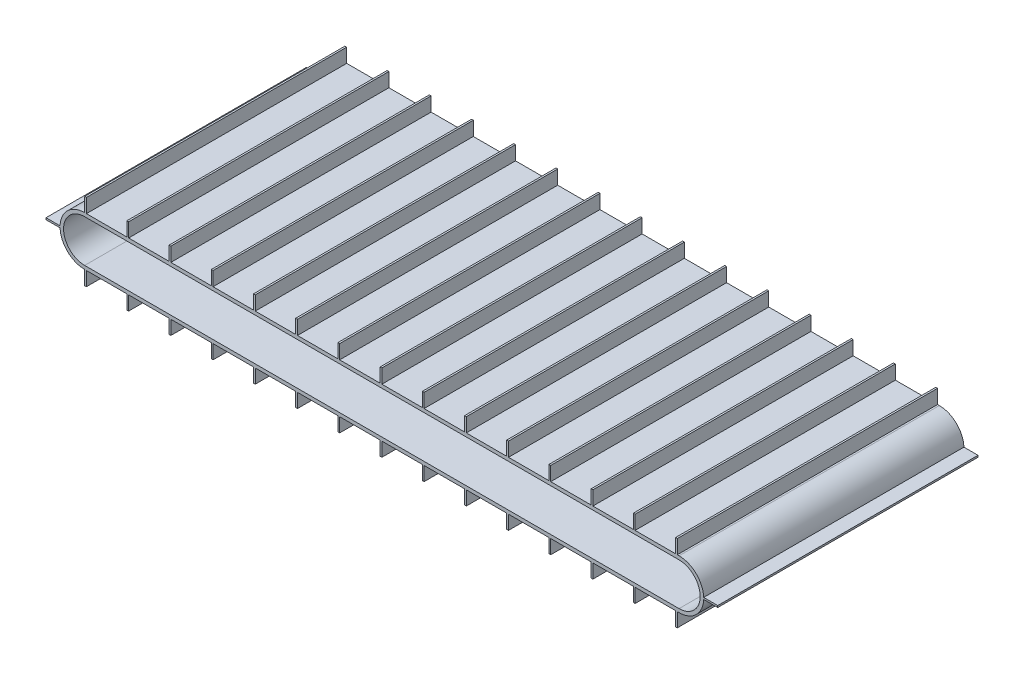
from build123d import *

# Parameters (mm, degrees)
BOSS_EXTRUDE1_DEPTH      = 234.95
SKETCH3_W                = 1.5875
SKETCH3_H                = 12.7
BOSS_EXTRUDE3_DEPTH      = 234.95
LPATTERN1_COUNT          = 15
LPATTERN1_PITCH          = 38.1
MIRROR1_COPY_1_SKETCH_W  = 1.5875
MIRROR1_COPY_1_SKETCH_H  = 12.7
MIRROR1_COPY_1_DEPTH     = 234.95
MIRROR1_COPY_2_SKETCH_W  = 1.5875
MIRROR1_COPY_2_SKETCH_H  = 12.7
MIRROR1_COPY_2_DEPTH     = 234.95
MIRROR1_COPY_3_SKETCH_W  = 1.5875
MIRROR1_COPY_3_SKETCH_H  = 12.7
MIRROR1_COPY_3_DEPTH     = 234.95
MIRROR1_COPY_4_SKETCH_W  = 1.5875
MIRROR1_COPY_4_SKETCH_H  = 12.7
MIRROR1_COPY_4_DEPTH     = 234.95
MIRROR1_COPY_5_SKETCH_W  = 1.5875
MIRROR1_COPY_5_SKETCH_H  = 12.7
MIRROR1_COPY_5_DEPTH     = 234.95
MIRROR1_COPY_6_SKETCH_W  = 1.5875
MIRROR1_COPY_6_SKETCH_H  = 12.7
MIRROR1_COPY_6_DEPTH     = 234.95
MIRROR1_COPY_7_SKETCH_W  = 1.5875
MIRROR1_COPY_7_SKETCH_H  = 12.7
MIRROR1_COPY_7_DEPTH     = 234.95
MIRROR1_COPY_8_SKETCH_W  = 1.5875
MIRROR1_COPY_8_SKETCH_H  = 12.7
MIRROR1_COPY_8_DEPTH     = 234.95
MIRROR1_COPY_9_SKETCH_W  = 1.5875
MIRROR1_COPY_9_SKETCH_H  = 12.7
MIRROR1_COPY_9_DEPTH     = 234.95
MIRROR1_COPY_10_SKETCH_W = 1.5875
MIRROR1_COPY_10_SKETCH_H = 12.7
MIRROR1_COPY_10_DEPTH    = 234.95
MIRROR1_COPY_11_SKETCH_W = 1.5875
MIRROR1_COPY_11_SKETCH_H = 12.7
MIRROR1_COPY_11_DEPTH    = 234.95
MIRROR1_COPY_12_SKETCH_W = 1.5875
MIRROR1_COPY_12_SKETCH_H = 12.7
MIRROR1_COPY_12_DEPTH    = 234.95
MIRROR1_COPY_13_SKETCH_W = 1.5875
MIRROR1_COPY_13_SKETCH_H = 12.7
MIRROR1_COPY_13_DEPTH    = 234.95
MIRROR1_COPY_14_SKETCH_W = 1.5875
MIRROR1_COPY_14_SKETCH_H = 12.7
MIRROR1_COPY_14_DEPTH    = 234.95
BOSS_EXTRUDE4_DEPTH      = 234.95
MIRROR2_START            = 577.835817532
MIRROR2_OUTLINE_W        = 1.5875
MIRROR2_OUTLINE_H        = 234.95
MIRROR2_DEPTH            = 12.700003838


# Read off the part's stored shape, not the designer's step: Mirror2
with BuildPart() as part:
    # Sketch1 → Boss-Extrude1 (new body)
    with BuildSketch(Plane.XY):
        with BuildLine():
            Line((19.050003843, -3.175), (555.624996157, -3.175))
            ThreePointArc((555.624996157, -3.175), (577.849996157, 19.05), (555.624996157, 41.275))
            Line((555.624996157, 41.275), (19.049996157, 41.275))
            ThreePointArc((19.049996157, 41.275), (-3.175, 19.049996157), (19.050003843, -3.175))
        make_face()
        with BuildLine():
            Line((19.049996157, 0), (555.624996157, 0))
            ThreePointArc((555.624996157, 0), (574.674996157, 19.05), (555.624996157, 38.1))
            Line((555.624996157, 38.1), (19.050000909, 38.1))
            ThreePointArc((19.050000909, 38.1), (0, 19.050002376), (19.049996157, 0))
        make_face(mode=Mode.SUBTRACT)
    extrude(amount=BOSS_EXTRUDE1_DEPTH)

    # Sketch3 → Boss-Extrude3 (add)
    with BuildSketch(Plane.XY):
        with Locations((19.843746157, 47.625)):
            Rectangle(SKETCH3_W, SKETCH3_H)
    boss_extrude3 = extrude(amount=BOSS_EXTRUDE3_DEPTH)

    # LPattern1: Boss-Extrude3 ×15
    with Locations(*[(i * LPATTERN1_PITCH, 0, 0) for i in range(1, LPATTERN1_COUNT)]):
        add(boss_extrude3)

    # Mirror1: Boss-Extrude3 across plane
    add(boss_extrude3.mirror(Plane.ZX.offset(19.05)))

    # Mirror1 copy 1 sketch → Mirror1 copy 1 (add)
    with BuildSketch(Plane(origin=(38.1, 38.1, 0), x_dir=(1, 0, 0), z_dir=(0, 0, 1))):
        with Locations((19.843746157, -47.625)):
            Rectangle(MIRROR1_COPY_1_SKETCH_W, MIRROR1_COPY_1_SKETCH_H)
    extrude(amount=MIRROR1_COPY_1_DEPTH)

    # Mirror1 copy 2 sketch → Mirror1 copy 2 (add)
    with BuildSketch(Plane(origin=(76.2, 38.1, 0), x_dir=(1, 0, 0), z_dir=(0, 0, 1))):
        with Locations((19.843746157, -47.625)):
            Rectangle(MIRROR1_COPY_2_SKETCH_W, MIRROR1_COPY_2_SKETCH_H)
    extrude(amount=MIRROR1_COPY_2_DEPTH)

    # Mirror1 copy 3 sketch → Mirror1 copy 3 (add)
    with BuildSketch(Plane(origin=(114.3, 38.1, 0), x_dir=(1, 0, 0), z_dir=(0, 0, 1))):
        with Locations((19.843746157, -47.625)):
            Rectangle(MIRROR1_COPY_3_SKETCH_W, MIRROR1_COPY_3_SKETCH_H)
    extrude(amount=MIRROR1_COPY_3_DEPTH)

    # Mirror1 copy 4 sketch → Mirror1 copy 4 (add)
    with BuildSketch(Plane(origin=(152.4, 38.1, 0), x_dir=(1, 0, 0), z_dir=(0, 0, 1))):
        with Locations((19.843746157, -47.625)):
            Rectangle(MIRROR1_COPY_4_SKETCH_W, MIRROR1_COPY_4_SKETCH_H)
    extrude(amount=MIRROR1_COPY_4_DEPTH)

    # Mirror1 copy 5 sketch → Mirror1 copy 5 (add)
    with BuildSketch(Plane(origin=(190.5, 38.1, 0), x_dir=(1, 0, 0), z_dir=(0, 0, 1))):
        with Locations((19.843746157, -47.625)):
            Rectangle(MIRROR1_COPY_5_SKETCH_W, MIRROR1_COPY_5_SKETCH_H)
    extrude(amount=MIRROR1_COPY_5_DEPTH)

    # Mirror1 copy 6 sketch → Mirror1 copy 6 (add)
    with BuildSketch(Plane(origin=(228.6, 38.1, 0), x_dir=(1, 0, 0), z_dir=(0, 0, 1))):
        with Locations((19.843746157, -47.625)):
            Rectangle(MIRROR1_COPY_6_SKETCH_W, MIRROR1_COPY_6_SKETCH_H)
    extrude(amount=MIRROR1_COPY_6_DEPTH)

    # Mirror1 copy 7 sketch → Mirror1 copy 7 (add)
    with BuildSketch(Plane(origin=(266.7, 38.1, 0), x_dir=(1, 0, 0), z_dir=(0, 0, 1))):
        with Locations((19.843746157, -47.625)):
            Rectangle(MIRROR1_COPY_7_SKETCH_W, MIRROR1_COPY_7_SKETCH_H)
    extrude(amount=MIRROR1_COPY_7_DEPTH)

    # Mirror1 copy 8 sketch → Mirror1 copy 8 (add)
    with BuildSketch(Plane(origin=(304.8, 38.1, 0), x_dir=(1, 0, 0), z_dir=(0, 0, 1))):
        with Locations((19.843746157, -47.625)):
            Rectangle(MIRROR1_COPY_8_SKETCH_W, MIRROR1_COPY_8_SKETCH_H)
    extrude(amount=MIRROR1_COPY_8_DEPTH)

    # Mirror1 copy 9 sketch → Mirror1 copy 9 (add)
    with BuildSketch(Plane(origin=(342.9, 38.1, 0), x_dir=(1, 0, 0), z_dir=(0, 0, 1))):
        with Locations((19.843746157, -47.625)):
            Rectangle(MIRROR1_COPY_9_SKETCH_W, MIRROR1_COPY_9_SKETCH_H)
    extrude(amount=MIRROR1_COPY_9_DEPTH)

    # Mirror1 copy 10 sketch → Mirror1 copy 10 (add)
    with BuildSketch(Plane(origin=(381, 38.1, 0), x_dir=(1, 0, 0), z_dir=(0, 0, 1))):
        with Locations((19.843746157, -47.625)):
            Rectangle(MIRROR1_COPY_10_SKETCH_W, MIRROR1_COPY_10_SKETCH_H)
    extrude(amount=MIRROR1_COPY_10_DEPTH)

    # Mirror1 copy 11 sketch → Mirror1 copy 11 (add)
    with BuildSketch(Plane(origin=(419.1, 38.1, 0), x_dir=(1, 0, 0), z_dir=(0, 0, 1))):
        with Locations((19.843746157, -47.625)):
            Rectangle(MIRROR1_COPY_11_SKETCH_W, MIRROR1_COPY_11_SKETCH_H)
    extrude(amount=MIRROR1_COPY_11_DEPTH)

    # Mirror1 copy 12 sketch → Mirror1 copy 12 (add)
    with BuildSketch(Plane(origin=(457.2, 38.1, 0), x_dir=(1, 0, 0), z_dir=(0, 0, 1))):
        with Locations((19.843746157, -47.625)):
            Rectangle(MIRROR1_COPY_12_SKETCH_W, MIRROR1_COPY_12_SKETCH_H)
    extrude(amount=MIRROR1_COPY_12_DEPTH)

    # Mirror1 copy 13 sketch → Mirror1 copy 13 (add)
    with BuildSketch(Plane(origin=(495.3, 38.1, 0), x_dir=(1, 0, 0), z_dir=(0, 0, 1))):
        with Locations((19.843746157, -47.625)):
            Rectangle(MIRROR1_COPY_13_SKETCH_W, MIRROR1_COPY_13_SKETCH_H)
    extrude(amount=MIRROR1_COPY_13_DEPTH)

    # Mirror1 copy 14 sketch → Mirror1 copy 14 (add)
    with BuildSketch(Plane(origin=(533.4, 38.1, 0), x_dir=(1, 0, 0), z_dir=(0, 0, 1))):
        with Locations((19.843746157, -47.625)):
            Rectangle(MIRROR1_COPY_14_SKETCH_W, MIRROR1_COPY_14_SKETCH_H)
    extrude(amount=MIRROR1_COPY_14_DEPTH)

    # Sketch4 → Boss-Extrude4 (add)
    with BuildSketch(Plane.XY):
        with BuildLine():
            Line((-3.16082137, 19.84375), (-15.86082137, 19.84375))
            Line((-15.86082137, 19.84375), (-15.86082137, 18.25625))
            Line((-15.86082137, 18.25625), (-3.16082137, 18.25625))
            ThreePointArc((-3.16082137, 18.25625), (-3.175, 19.05), (-3.16082137, 19.84375))
        make_face()
    extrude(amount=BOSS_EXTRUDE4_DEPTH)

    # Mirror2 outline → Mirror2 (add)
    with BuildSketch(Plane.YZ.offset(MIRROR2_START)):
        with Locations((19.05, 117.475)):
            Rectangle(MIRROR2_OUTLINE_W, MIRROR2_OUTLINE_H)
    extrude(amount=MIRROR2_DEPTH)


solid = part.part
